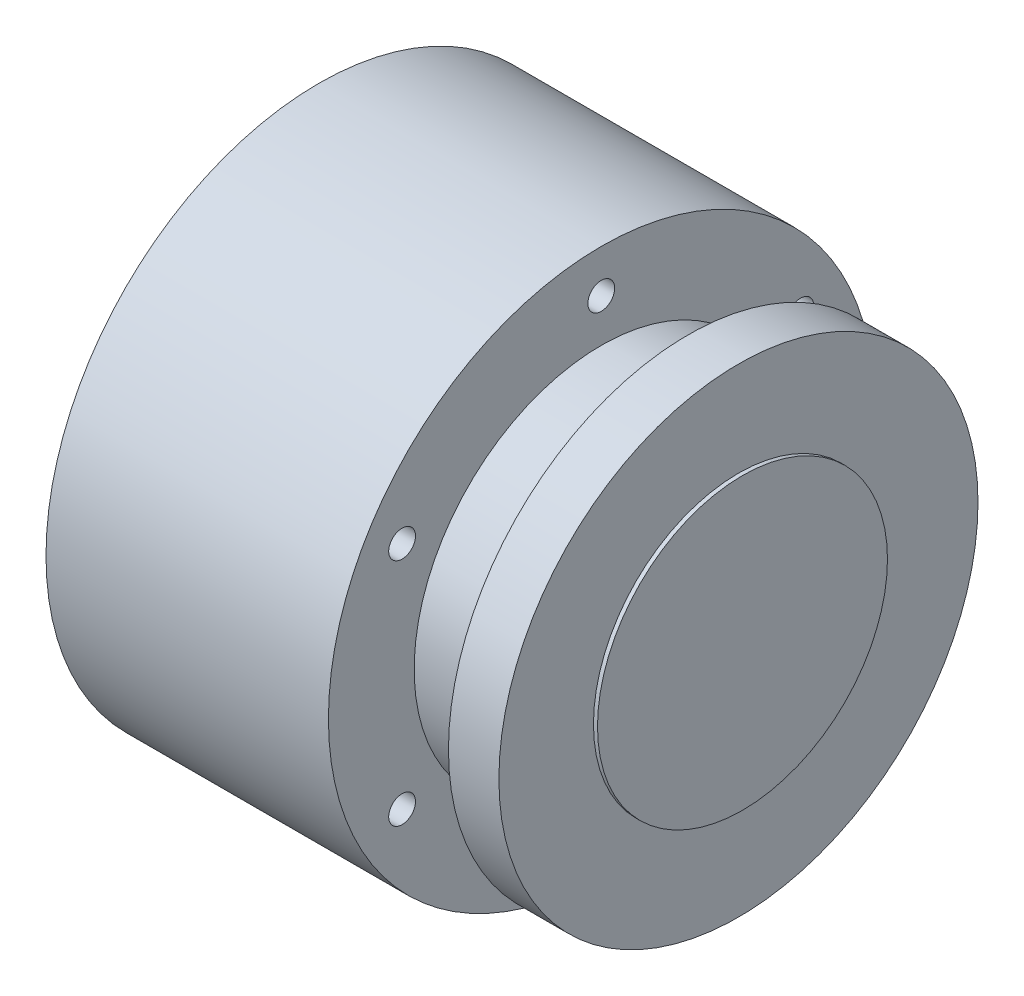
from build123d import *

# Parameters (mm, degrees)
SKETCH1_3_W        = 12.7
SKETCH1_3_H        = 23.8125
SKETCH3_R          = 3.3734375
CUT_EXTRUDE1_DEPTH = 13.97
SKETCH5_R          = 3.3734375
CUT_EXTRUDE2_DEPTH = 13.97


with BuildPart() as part:
    # Sketch1 → Revolve1 (revolve)
    with BuildSketch(Plane(origin=(0, 0, 0), x_dir=(-1, 0, 0), z_dir=(0, 1, 0))):
        Polygon((0, 68.707), (0, 47.117), (-20.32, 47.117), (-20.32, 36.5125), (-35.56, 36.5125), (-35.56, 0), (71.12, 0), (71.12, 68.707), align=None)
    revolve(axis=Axis((0, 0, 0), (-1, 0, 0)))

    # Sketch3 → Cut-Extrude1 (cut)
    with BuildSketch(Plane(origin=(-71.12, 0, 0), x_dir=(0, -1, 0), z_dir=(-1, 0, 0))):
        with Locations((-22.394618112, 30.823547486)):
            Circle(SKETCH3_R)
        with Locations((22.394618112, 30.823547486)):
            Circle(SKETCH3_R)
        with Locations((36.235253271, -11.773547486)):
            Circle(SKETCH3_R)
        with Locations((0, -38.1)):
            Circle(SKETCH3_R)
        with Locations((-36.235253271, -11.773547486)):
            Circle(SKETCH3_R)
    extrude(amount=-CUT_EXTRUDE1_DEPTH, mode=Mode.SUBTRACT)

    # Sketch5 → Cut-Extrude2 (cut)
    with BuildSketch(Plane.YZ):
        with Locations((28.956, 50.153263184)):
            Circle(SKETCH5_R)
        with Locations((-28.956, 50.153263184)):
            Circle(SKETCH5_R)
        with Locations((-57.912, 0)):
            Circle(SKETCH5_R)
        with Locations((-28.956, -50.153263184)):
            Circle(SKETCH5_R)
        with Locations((28.956, -50.153263184)):
            Circle(SKETCH5_R)
        with Locations((57.912, 0)):
            Circle(SKETCH5_R)
    extrude(amount=-CUT_EXTRUDE2_DEPTH, mode=Mode.SUBTRACT)


with BuildPart() as body_2:
    # Sketch1<3> → Revolve2 (revolve)
    with BuildSketch(Plane(origin=(0, 0, 0), x_dir=(-1, 0, 0), z_dir=(0, 1, 0))):
        with Locations((-28.194, 48.41875)):
            Rectangle(SKETCH1_3_W, SKETCH1_3_H)
    revolve(axis=Axis((0, 0, 0), (-1, 0, 0)))


solid = Compound([part.part, body_2.part])
